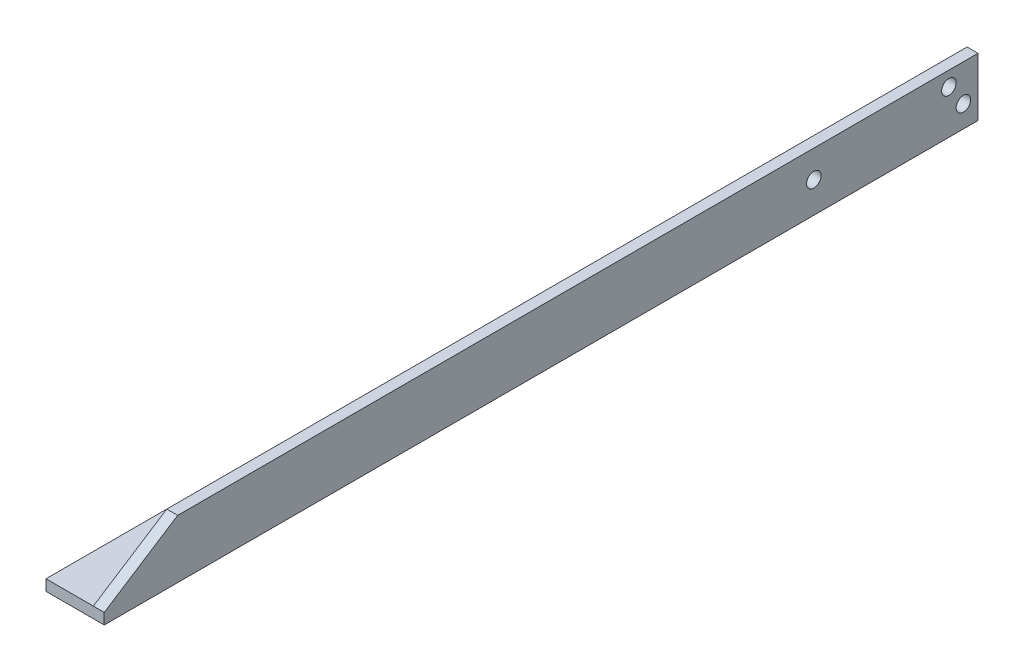
from build123d import *

# Parameters (mm, degrees)
BOSS_EXTRUDE1_DEPTH     = 381
CUT_EXTRUDE3_DEPTH      = 383.403015687
CUT_EXTRUDE3_DEPTH_BACK = 383.403015687
CUT_EXTRUDE4_REACH      = 384.403
SKETCH6_R               = 3.175
CUT_EXTRUDE5_REACH      = 384.69
SKETCH7_R               = 3.175
CUT_EXTRUDE6_REACH      = 384.403
SKETCH8_R               = 3.175


with BuildPart() as part:
    # Sketch1 → Boss-Extrude1 (new body)
    with BuildSketch(Plane.XY):
        Polygon((0, 0), (0, -25.4), (-25.4, -25.4), (-25.4, -20.6375), (-4.7625, -20.6375), (-4.7625, 0), align=None)
    extrude(amount=BOSS_EXTRUDE1_DEPTH)

    # Sketch4 → Cut-Extrude3 (cut, two sides: drawn at the far end of the back side and taken through both)
    with BuildSketch(Plane.ZY.offset(4.7625).offset(-CUT_EXTRUDE3_DEPTH_BACK)):
        Polygon((1030.877066877, -439.409233154), (381, -20.6375), (348.97339241, 0), (-300.903674467, 418.771733154), (536.63979184, 1718.525866908), (1868.420533185, 860.3449006), align=None)
    extrude(amount=CUT_EXTRUDE3_DEPTH + CUT_EXTRUDE3_DEPTH_BACK, mode=Mode.SUBTRACT)

    # Sketch6 → Cut-Extrude4 (cut, up to next)
    with BuildSketch(Plane.ZY.offset(4.7625), mode=Mode.PRIVATE) as cut_extrude4_sk1:
        with Locations((6.35, -15.875)):
            Circle(SKETCH6_R)
    cut_extrude4_tool1 = extrude(cut_extrude4_sk1.sketch, amount=-CUT_EXTRUDE4_REACH, mode=Mode.PRIVATE) & part.part
    # Sketch6 → Cut-Extrude4 (cut, up to next)
    with BuildSketch(Plane.ZY.offset(4.7625), mode=Mode.PRIVATE) as cut_extrude4_sk2:
        with Locations((12.7, -6.35)):
            Circle(SKETCH6_R)
    cut_extrude4_tool2 = extrude(cut_extrude4_sk2.sketch, amount=-CUT_EXTRUDE4_REACH, mode=Mode.PRIVATE) & part.part
    add(cut_extrude4_tool1.solids().sort_by_distance((-4.7625, -15.875, 6.35))[0], mode=Mode.SUBTRACT)
    add(cut_extrude4_tool2.solids().sort_by_distance((-4.7625, -6.35, 12.7))[0], mode=Mode.SUBTRACT)

    # Sketch7 → Cut-Extrude5 (cut, up to next)
    with BuildSketch(Plane(origin=(0, 0, 0), x_dir=(0, 0, -1), z_dir=(1, 0, 0)), mode=Mode.PRIVATE) as cut_extrude5_sk1:
        with Locations((-71.569677029, -11.929615818)):
            Circle(SKETCH7_R)
    cut_extrude5_tool1 = extrude(cut_extrude5_sk1.sketch, amount=-CUT_EXTRUDE5_REACH, mode=Mode.PRIVATE) & part.part
    add(cut_extrude5_tool1.solids().sort_by_distance((0, -11.929616, 71.569677))[0], mode=Mode.SUBTRACT)

    # Sketch8 → Cut-Extrude6 (cut, up to next)
    with BuildSketch(Plane(origin=(0, -20.6375, 0), x_dir=(1, 0, 0), z_dir=(0, 1, 0)), mode=Mode.PRIVATE) as cut_extrude6_sk1:
        with Locations((-15.08125, -12.7)):
            Circle(SKETCH8_R)
    cut_extrude6_tool1 = extrude(cut_extrude6_sk1.sketch, amount=-CUT_EXTRUDE6_REACH, mode=Mode.PRIVATE) & part.part
    add(cut_extrude6_tool1.solids().sort_by_distance((-15.08125, -20.6375, 12.7))[0], mode=Mode.SUBTRACT)


solid = part.part
